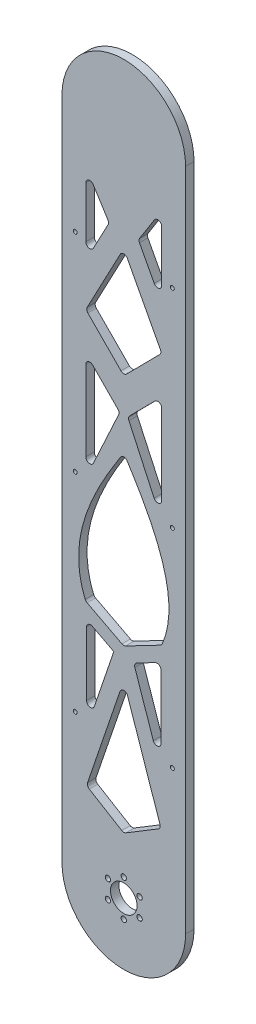
from build123d import *

# Parameters (mm, degrees)
SKETCH2_R           = 10
SKETCH2_R_2         = 2
BOSS_EXTRUDE1_DEPTH = 6.35
CUT_EXTRUDE1_DEPTH  = 10
FILLET3_R           = 3
SKETCH5_R           = 1.5
CUT_EXTRUDE2_DEPTH  = 549.511460792


with BuildPart() as part:
    # Sketch2 → Boss-Extrude1 (new body)
    with BuildSketch(Plane.XY):
        with BuildLine():
            Line((-46.5, 0), (-46.5, 500))
            ThreePointArc((-46.5, 500), (0, 546.5), (46.5, 500))
            Line((46.5, 500), (46.5, 0))
            ThreePointArc((46.5, 0), (0, -46.5), (-46.5, 0))
        make_face()
        Circle(SKETCH2_R, mode=Mode.SUBTRACT)
        with Locations((0, 13.75)):
            Circle(SKETCH2_R_2, mode=Mode.SUBTRACT)
        with Locations((11.907849302, 6.875)):
            Circle(SKETCH2_R_2, mode=Mode.SUBTRACT)
        with Locations((11.907849302, -6.875)):
            Circle(SKETCH2_R_2, mode=Mode.SUBTRACT)
        with Locations((0, -13.75)):
            Circle(SKETCH2_R_2, mode=Mode.SUBTRACT)
        with Locations((-11.907849302, -6.875)):
            Circle(SKETCH2_R_2, mode=Mode.SUBTRACT)
        with Locations((-11.907849302, 6.875)):
            Circle(SKETCH2_R_2, mode=Mode.SUBTRACT)
    extrude(amount=BOSS_EXTRUDE1_DEPTH)

    # Sketch4 → Cut-Extrude1 (cut)
    with BuildSketch(Plane.XY.offset(6.35)):
        Polygon((28.005258112, 59.37595418), (0, 42.411661153), (-28.005258112, 59.37595418), (0, 141.693437584), align=None)
        Polygon((-7.5, 156.905935087), (-28.005258112, 96.633637735), (-28.005258112, 167.582877854), align=None)
        Polygon((28.005258112, 167.582877854), (7.5, 156.905935087), (28.005258112, 96.633637735), align=None)
        with BuildLine():
            Line((0, 164.275138905), (28.550546746, 179.141206521))
            add(Edge.make_bspline(
                [(28.550546746, 179.141206521), (45.32025339, 216.985654627), (19.430092874, 259.790255689), (0, 290.025756679)],
                knots=[0, 0, 0, 0, 1, 1, 1, 1], degree=3))
            add(Edge.make_bspline(
                [(-28.550546746, 179.141206521), (-45.32025339, 216.985654627), (-19.430092874, 259.790255689), (0, 290.025756679)],
                knots=[0, 0, 0, 0, 1, 1, 1, 1], degree=3))
            Line((-28.550546746, 179.141206521), (0, 164.275138905))
        make_face()
        Polygon((28.550546746, 259.58677623), (3, 314.938284003), (28.550546746, 340.793051053), align=None)
        Polygon((-3, 314.938284003), (-28.550546746, 340.793051053), (-28.550546746, 259.58677623), align=None)
        Polygon((0, 423.142843498), (-28.550546746, 369.246205395), (0, 340.355718526), (28.550546746, 369.246205395), align=None)
        Polygon((-28.550546746, 462.095190817), (-28.550546746, 401.290241252), (-11, 434.421497018), align=None)
        Polygon((28.550546746, 401.290241252), (11, 434.421497018), (28.550546746, 462.095190817), align=None)
    extrude(amount=-CUT_EXTRUDE1_DEPTH, mode=Mode.SUBTRACT)

    # Fillet3
    fillet3_edges = [part.edges().sort_by_distance(p)[0] for p in [
        (-11, 434.421497018, 3.175),
        (-28.550546746, 401.290241252, 3.175),
        (28.550546746, 401.290241252, 3.175),
        (11, 434.421497018, 3.175),
        (28.550546746, 462.095190817, 3.175),
        (-28.550546746, 462.095190817, 3.175),
        (0, 423.142843498, 3.175),
        (-28.550546746, 369.246205395, 3.175),
        (28.550546746, 369.246205395, 3.175),
        (0, 340.355718526, 3.175),
        (28.550546746, 340.793051053, 3.175),
        (-28.550546746, 340.793051053, 3.175),
        (-3, 314.938284003, 3.175),
        (3, 314.938284003, 3.175),
        (28.550546746, 259.58677623, 3.175),
        (-28.550546746, 259.58677623, 3.175),
        (28.550546746, 179.141206521, 3.175),
        (0, 290.025756679, 3.175),
        (-28.550546746, 179.141206521, 3.175),
        (0, 164.275138905, 3.175),
        (-28.005258112, 96.633637735, 3.175),
        (28.005258112, 96.633637735, 3.175),
        (7.5, 156.905935087, 3.175),
        (-28.005258112, 167.582877854, 3.175),
        (28.005258112, 167.582877854, 3.175),
        (0, 141.693437584, 3.175),
        (28.005258112, 59.37595418, 3.175),
        (-28.005258112, 59.37595418, 3.175),
        (0, 42.411661153, 3.175),
    ]]
    fillet(fillet3_edges, radius=FILLET3_R)

    # Sketch5 → Cut-Extrude2 (cut, through all)
    with BuildSketch(Plane.XY.offset(6.35)):
        with Locations((36.5, 103.175)):
            Circle(SKETCH5_R)
        with Locations((-36.5, 103.175)):
            Circle(SKETCH5_R)
        with Locations((36.5, 259.525)):
            Circle(SKETCH5_R)
        with Locations((-36.5, 259.525)):
            Circle(SKETCH5_R)
        with Locations((36.5, 415.875)):
            Circle(SKETCH5_R)
        with Locations((-36.5, 415.875)):
            Circle(SKETCH5_R)
    extrude(amount=-CUT_EXTRUDE2_DEPTH, mode=Mode.SUBTRACT)


solid = part.part
